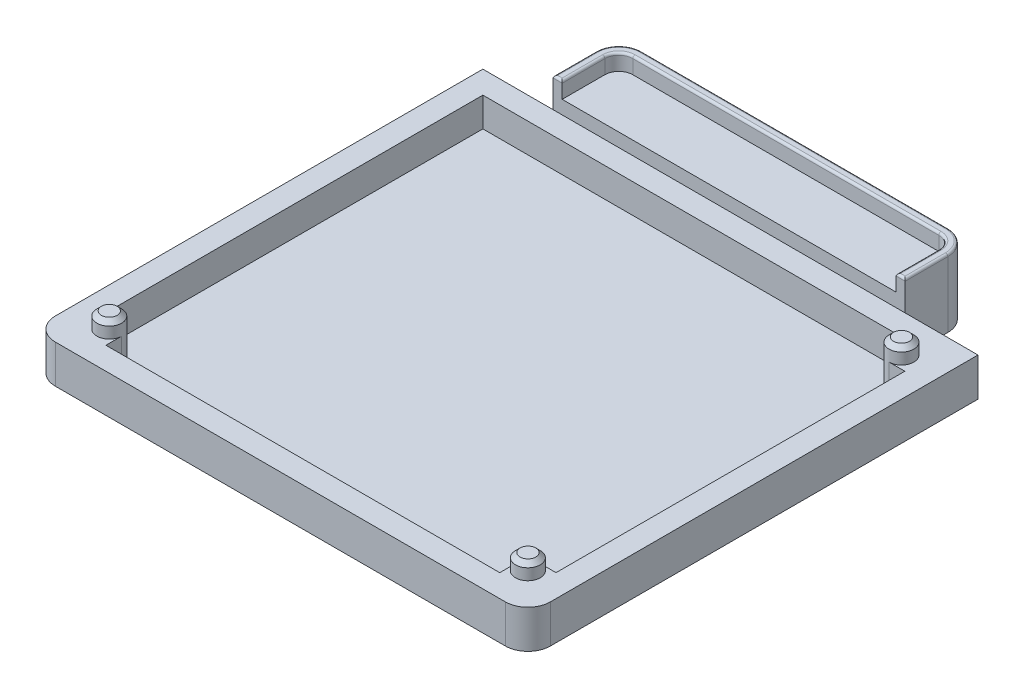
from build123d import *

# Parameters (mm, degrees)
SKETCH1_W           = 110
SKETCH1_H           = 100
BOSS_EXTRUDE1_DEPTH = 2
SKETCH2_W           = 110
SKETCH2_H           = 100
SKETCH2_W_2         = 100
SKETCH2_H_2         = 90
BOSS_EXTRUDE2_DEPTH = 6.5
BOSS_EXTRUDE3_DEPTH = 13.5
BOSS_EXTRUDE4_START = -15.1
BOSS_EXTRUDE4_DEPTH = 1.6
SKETCH4_R           = 2.75
BOSS_EXTRUDE5_DEPTH = 6.5
SKETCH4_3_R         = 2.75
BOSS_EXTRUDE6_DEPTH = 10
CHAMFER1_SIZE       = 1
FILLET1_R           = 5
FILLET2_R           = 0.5
CUT_EXTRUDE1_DEPTH  = 2


# Read off the part's stored shape, not the designer's step: Boss-Extrude4
with BuildPart() as part:
    # Sketch1 → Boss-Extrude1 (new body)
    with BuildSketch(Plane(origin=(0, 0, 0), x_dir=(1, 0, 0), z_dir=(0, 1, 0))):
        Rectangle(SKETCH1_W, SKETCH1_H)
    extrude(amount=BOSS_EXTRUDE1_DEPTH)

    # Sketch2 → Boss-Extrude2 (add)
    with BuildSketch(Plane(origin=(0, 2, 0), x_dir=(1, 0, 0), z_dir=(0, 1, 0))):
        Rectangle(SKETCH2_W, SKETCH2_H)
        Rectangle(SKETCH2_W_2, SKETCH2_H_2, mode=Mode.SUBTRACT)
    extrude(amount=BOSS_EXTRUDE2_DEPTH)

    # Sketch3 → Boss-Extrude3 (add)
    with BuildSketch(Plane.XZ):
        with BuildLine():
            Line((-39.37766222, -50), (-39.37766222, -59.477632813))
            ThreePointArc((-39.37766222, -59.477632813), (-37.883906804, -63.083877397), (-34.27766222, -64.577632813))
            Line((-34.27766222, -64.577632813), (33.72233778, -64.577632813))
            ThreePointArc((33.72233778, -64.577632813), (37.328582364, -63.083877397), (38.82233778, -59.477632813))
            Line((38.82233778, -59.477632813), (38.82233778, -50))
            Line((38.82233778, -50), (-39.37766222, -50))
        make_face()
    extrude(amount=-BOSS_EXTRUDE3_DEPTH)

    # Boss-Extrude4 outline → Boss-Extrude4 (add)
    with BuildSketch(Plane.XZ.offset(BOSS_EXTRUDE4_START)):
        with BuildLine():
            Line((38.82233778, -59.477632813), (38.82233778, -50))
            Line((38.82233778, -50), (36.82233778, -50))
            Line((36.82233778, -50), (36.82233778, -59.477632813))
            ThreePointArc((36.82233778, -59.477632813), (35.914368802, -61.669663835), (33.72233778, -62.577632813))
            Line((33.72233778, -62.577632813), (-34.27766222, -62.577632813))
            ThreePointArc((-34.27766222, -62.577632813), (-36.469693242, -61.669663835), (-37.37766222, -59.477632813))
            Line((-37.37766222, -59.477632813), (-37.37766222, -50))
            Line((-37.37766222, -50), (-39.37766222, -50))
            Line((-39.37766222, -50), (-39.37766222, -59.477632813))
            ThreePointArc((-39.37766222, -59.477632813), (-37.883906804, -63.083877397), (-34.27766222, -64.577632813))
            Line((-34.27766222, -64.577632813), (33.72233778, -64.577632813))
            ThreePointArc((33.72233778, -64.577632813), (37.328582364, -63.083877397), (38.82233778, -59.477632813))
        make_face()
    extrude(amount=BOSS_EXTRUDE4_DEPTH)

    # Sketch4 → Boss-Extrude5 (add)
    with BuildSketch(Plane(origin=(0, 2, 0), x_dir=(1, 0, 0), z_dir=(0, 1, 0))):
        with BuildLine():
            Line((-50, -38.75), (-50, -45))
            Line((-50, -45), (-43.75, -45))
            Line((-43.75, -45), (-43.75, -41.5))
            ThreePointArc((-43.75, -41.5), (-48.444543648, -43.444543648), (-46.5, -38.75))
            Line((-46.5, -38.75), (-50, -38.75))
        make_face()
        with Locations((-46.5, -41.5)):
            Circle(SKETCH4_R)
        with BuildLine():
            Line((43.75, -41.5), (43.75, -45))
            Line((43.75, -45), (50, -45))
            Line((50, -45), (50, -38.75))
            Line((50, -38.75), (46.5, -38.75))
            ThreePointArc((46.5, -38.75), (48.444543648, -39.555456352), (49.25, -41.5))
            ThreePointArc((49.25, -41.5), (46.5, -44.25), (43.75, -41.5))
        make_face()
        with Locations((46.5, -41.5)):
            Circle(SKETCH4_R)
        with Locations((46.5, 41.5)):
            Circle(SKETCH4_R)
        with BuildLine():
            Line((50, 45), (43.75, 45))
            Line((43.75, 45), (43.75, 41.5))
            ThreePointArc((43.75, 41.5), (46.5, 44.25), (49.25, 41.5))
            ThreePointArc((49.25, 41.5), (48.444543648, 39.555456352), (46.5, 38.75))
            Line((46.5, 38.75), (50, 38.75))
            Line((50, 38.75), (50, 45))
        make_face()
    extrude(amount=BOSS_EXTRUDE5_DEPTH)

    # Sketch4<3> → Boss-Extrude6 (add)
    with BuildSketch(Plane(origin=(0, 2, 0), x_dir=(1, 0, 0), z_dir=(0, 1, 0))):
        with Locations(Location((46.5, 41.5, 0), (0, 0, 270))):
            Circle(SKETCH4_3_R)
        with Locations(Location((46.5, -41.5, 0), (0, 0, 90))):
            Circle(SKETCH4_3_R)
        with Locations(Location((-46.5, -41.5, 0), (0, 0, 90))):
            Circle(SKETCH4_3_R)
    extrude(amount=BOSS_EXTRUDE6_DEPTH)

    # Chamfer1
    chamfer1_edges = [part.edges().sort_by_distance(p)[0] for p in [
        (46.5, 12, -44.25),
        (46.5, 12, 44.25),
        (-46.5, 12, 44.25),
    ]]
    chamfer(chamfer1_edges, length=CHAMFER1_SIZE)

    # Fillet1
    fillet1_edges = [part.edges().sort_by_distance(p)[0] for p in [
        (55, 4.25, 50),
        (-55, 4.25, 50),
    ]]
    fillet(fillet1_edges, radius=FILLET1_R)

    # Fillet2
    fillet2_edges = [part.edges().sort_by_distance(p)[0] for p in [
        (35.914368802, 15.1, -61.669663835),
        (37.82233778, 15.1, -50),
        (38.82233778, 15.1, -54.738816406),
        (-0.27766222, 15.1, -64.577632813),
        (-39.37766222, 15.1, -54.738816406),
        (-38.37766222, 15.1, -50),
        (-36.469693242, 15.1, -61.669663835),
        (-0.27766222, 15.1, -62.577632813),
        (-37.37766222, 15.1, -54.738816406),
        (-37.883906804, 15.1, -63.083877397),
        (37.328582364, 15.1, -63.083877397),
        (36.82233778, 15.1, -54.738816406),
    ]]
    fillet(fillet2_edges, radius=FILLET2_R)

    # Sketch5 → Cut-Extrude1 (cut)
    with BuildSketch(Plane(origin=(0, 13.5, 0), x_dir=(1, 0, 0), z_dir=(0, 1, 0))):
        with BuildLine():
            Line((-37.37766222, 59.477632813), (-37.37766222, 50))
            Line((-37.37766222, 50), (36.82233778, 50))
            Line((36.82233778, 50), (36.82233778, 59.477632813))
            ThreePointArc((36.82233778, 59.477632813), (35.914368802, 61.669663835), (33.72233778, 62.577632813))
            Line((33.72233778, 62.577632813), (-34.27766222, 62.577632813))
            ThreePointArc((-34.27766222, 62.577632813), (-36.469693242, 61.669663835), (-37.37766222, 59.477632813))
        make_face()
    extrude(amount=-CUT_EXTRUDE1_DEPTH, mode=Mode.SUBTRACT)


solid = part.part
